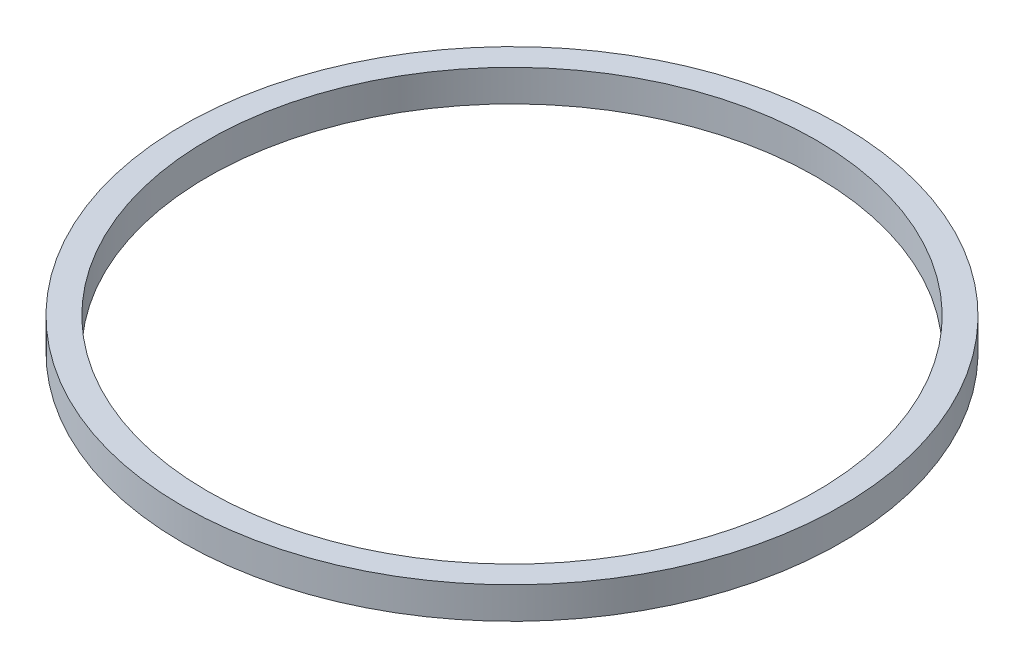
from build123d import *

# Parameters (mm, degrees)
SKETCH1_R           = 26
SKETCH1_R_2         = 24
BOSS_EXTRUDE1_DEPTH = 2.5


with BuildPart() as part:
    # Sketch1 → Boss-Extrude1 (new body)
    with BuildSketch(Plane(origin=(0, 0, 0), x_dir=(1, 0, 0), z_dir=(0, 1, 0))):
        Circle(SKETCH1_R)
        Circle(SKETCH1_R_2, mode=Mode.SUBTRACT)
    extrude(amount=BOSS_EXTRUDE1_DEPTH)


solid = part.part
